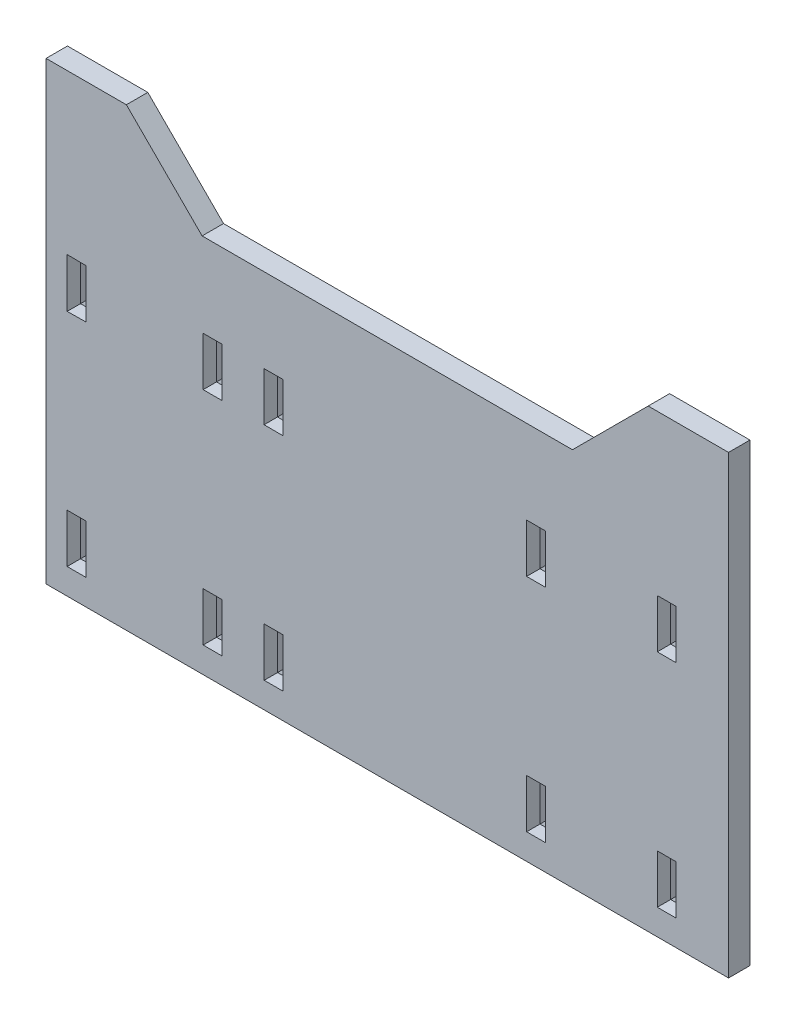
from build123d import *
from OCP.BRepFilletAPI import BRepFilletAPI_MakeChamfer

# Parameters (mm, degrees)
SKETCH1_W           = 127.440194606
SKETCH1_H           = 60
SKETCH1_W_2         = 3.53
SKETCH1_H_2         = 9.11399265
BOSS_EXTRUDE1_DEPTH = 4
BOSS_EXTRUDE2_DEPTH = 4
CHAMFER1_SIZE       = 1.5
CHAMFER1_SIZE2      = 0.5


with BuildPart() as part:
    # Sketch1 → Boss-Extrude1 (new body)
    with BuildSketch(Plane.XY):
        Rectangle(SKETCH1_W, SKETCH1_H)
        with Locations((-32.620097303, 20.65)):
            Rectangle(SKETCH1_W_2, SKETCH1_H_2, mode=Mode.SUBTRACT)
        with Locations((27.7799027, 20.65)):
            Rectangle(SKETCH1_W_2, SKETCH1_H_2, mode=Mode.SUBTRACT)
        with Locations((27.7799027, -20.65)):
            Rectangle(SKETCH1_W_2, SKETCH1_H_2, mode=Mode.SUBTRACT)
        Polygon((-19.455133439, 25.206990566), (-22.985061166, 25.184401952), (-22.999551776, 16.115598048), (-19.440642829, 16.093009434), align=None, mode=Mode.SUBTRACT)
        with Locations((-21.220097303, -20.65)):
            Rectangle(SKETCH1_W_2, SKETCH1_H_2, mode=Mode.SUBTRACT)
        with Locations((52.1799027, 20.65)):
            Rectangle(SKETCH1_W_2, SKETCH1_H_2, mode=Mode.SUBTRACT)
        with Locations((52.1799027, -20.65)):
            Rectangle(SKETCH1_W_2, SKETCH1_H_2, mode=Mode.SUBTRACT)
        with Locations((-32.620097303, -20.65)):
            Rectangle(SKETCH1_W_2, SKETCH1_H_2, mode=Mode.SUBTRACT)
        Polygon((-59.784966326, 25.25), (-56.255228279, 25.206996325), (-56.255228279, 16.093003675), (-59.784966326, 16.05), align=None, mode=Mode.SUBTRACT)
        with Locations((-58.020097303, -20.65)):
            Rectangle(SKETCH1_W_2, SKETCH1_H_2, mode=Mode.SUBTRACT)
    extrude(amount=-BOSS_EXTRUDE1_DEPTH)

    # Sketch2 → Boss-Extrude2 (add)
    with BuildSketch(Plane.XY):
        Polygon((-63.720097303, 30), (-63.720097303, 55), (-48.720097303, 55), (-34.577961679, 40.857864376), (34.577961679, 40.857864376), (48.720097303, 55), (63.720097303, 55), (63.720097303, 30), align=None)
    extrude(amount=-BOSS_EXTRUDE2_DEPTH)

    # Chamfer1: one chamfer whose edges measure the first distance from different faces: ONE call of the kernel's chamfer builder (chamfer() names one face for all edges)
    chamfer1_edges_1 = [part.edges().sort_by_distance(p)[0] for p in [
        (27.7799027, 16.093003675, -4),
    ]]
    chamfer1_side_1 = [part.faces().sort_by_distance(p)[0] for p in [
        (27.7799027, 16.093003675, -2),
    ]]
    chamfer1_edges_2 = [part.edges().sort_by_distance(p)[0] for p in [
        (29.5449027, 20.65, -4),
    ]]
    chamfer1_side_2 = [part.faces().sort_by_distance(p)[0] for p in [
        (29.5449027, 20.65, -2),
    ]]
    chamfer1_edges_3 = [part.edges().sort_by_distance(p)[0] for p in [
        (26.0149027, 20.65, -4),
    ]]
    chamfer1_side_3 = [part.faces().sort_by_distance(p)[0] for p in [
        (26.0149027, 20.65, -2),
    ]]
    chamfer1_edges_4 = [part.edges().sort_by_distance(p)[0] for p in [
        (27.7799027, 25.206996325, -4),
    ]]
    chamfer1_side_4 = [part.faces().sort_by_distance(p)[0] for p in [
        (27.7799027, 25.206996325, -2),
    ]]
    chamfer1_edges_5 = [part.edges().sort_by_distance(p)[0] for p in [
        (53.9449027, 20.65, -4),
    ]]
    chamfer1_side_5 = [part.faces().sort_by_distance(p)[0] for p in [
        (53.9449027, 20.65, -2),
    ]]
    chamfer1_edges_6 = [part.edges().sort_by_distance(p)[0] for p in [
        (52.1799027, 16.093003675, -4),
    ]]
    chamfer1_side_6 = [part.faces().sort_by_distance(p)[0] for p in [
        (52.1799027, 16.093003675, -2),
    ]]
    chamfer1_edges_7 = [part.edges().sort_by_distance(p)[0] for p in [
        (50.4149027, 20.65, -4),
    ]]
    chamfer1_side_7 = [part.faces().sort_by_distance(p)[0] for p in [
        (50.4149027, 20.65, -2),
    ]]
    chamfer1_edges_8 = [part.edges().sort_by_distance(p)[0] for p in [
        (52.1799027, 25.206996325, -4),
    ]]
    chamfer1_side_8 = [part.faces().sort_by_distance(p)[0] for p in [
        (52.1799027, 25.206996325, -2),
    ]]
    chamfer1_edges_9 = [part.edges().sort_by_distance(p)[0] for p in [
        (52.1799027, -25.206996325, -4),
    ]]
    chamfer1_side_9 = [part.faces().sort_by_distance(p)[0] for p in [
        (52.1799027, -25.206996325, -2),
    ]]
    chamfer1_edges_10 = [part.edges().sort_by_distance(p)[0] for p in [
        (53.9449027, -20.65, -4),
    ]]
    chamfer1_side_10 = [part.faces().sort_by_distance(p)[0] for p in [
        (53.9449027, -20.65, -2),
    ]]
    chamfer1_edges_11 = [part.edges().sort_by_distance(p)[0] for p in [
        (52.1799027, -16.093003675, -4),
    ]]
    chamfer1_side_11 = [part.faces().sort_by_distance(p)[0] for p in [
        (52.1799027, -16.093003675, -2),
    ]]
    chamfer1_edges_12 = [part.edges().sort_by_distance(p)[0] for p in [
        (50.4149027, -20.65, -4),
    ]]
    chamfer1_side_12 = [part.faces().sort_by_distance(p)[0] for p in [
        (50.4149027, -20.65, -2),
    ]]
    chamfer1_edges_13 = [part.edges().sort_by_distance(p)[0] for p in [
        (29.5449027, -20.65, -4),
    ]]
    chamfer1_side_13 = [part.faces().sort_by_distance(p)[0] for p in [
        (29.5449027, -20.65, -2),
    ]]
    chamfer1_edges_14 = [part.edges().sort_by_distance(p)[0] for p in [
        (27.7799027, -25.206996325, -4),
    ]]
    chamfer1_side_14 = [part.faces().sort_by_distance(p)[0] for p in [
        (27.7799027, -25.206996325, -2),
    ]]
    chamfer1_edges_15 = [part.edges().sort_by_distance(p)[0] for p in [
        (26.0149027, -20.65, -4),
    ]]
    chamfer1_side_15 = [part.faces().sort_by_distance(p)[0] for p in [
        (26.0149027, -20.65, -2),
    ]]
    chamfer1_edges_16 = [part.edges().sort_by_distance(p)[0] for p in [
        (27.7799027, -16.093003675, -4),
    ]]
    chamfer1_side_16 = [part.faces().sort_by_distance(p)[0] for p in [
        (27.7799027, -16.093003675, -2),
    ]]
    chamfer1_edges_17 = [part.edges().sort_by_distance(p)[0] for p in [
        (-21.220097303, -25.206996325, -4),
    ]]
    chamfer1_side_17 = [part.faces().sort_by_distance(p)[0] for p in [
        (-21.220097303, -25.206996325, -2),
    ]]
    chamfer1_edges_18 = [part.edges().sort_by_distance(p)[0] for p in [
        (-19.455097303, -20.65, -4),
    ]]
    chamfer1_side_18 = [part.faces().sort_by_distance(p)[0] for p in [
        (-19.455097303, -20.65, -2),
    ]]
    chamfer1_edges_19 = [part.edges().sort_by_distance(p)[0] for p in [
        (-21.220097303, -16.093003675, -4),
    ]]
    chamfer1_side_19 = [part.faces().sort_by_distance(p)[0] for p in [
        (-21.220097303, -16.093003675, -2),
    ]]
    chamfer1_edges_20 = [part.edges().sort_by_distance(p)[0] for p in [
        (-22.985097303, -20.65, -4),
    ]]
    chamfer1_side_20 = [part.faces().sort_by_distance(p)[0] for p in [
        (-22.985097303, -20.65, -2),
    ]]
    chamfer1_edges_21 = [part.edges().sort_by_distance(p)[0] for p in [
        (-30.855097303, -20.65, -4),
    ]]
    chamfer1_side_21 = [part.faces().sort_by_distance(p)[0] for p in [
        (-30.855097303, -20.65, -2),
    ]]
    chamfer1_edges_22 = [part.edges().sort_by_distance(p)[0] for p in [
        (-32.620097303, -25.206996325, -4),
    ]]
    chamfer1_side_22 = [part.faces().sort_by_distance(p)[0] for p in [
        (-32.620097303, -25.206996325, -2),
    ]]
    chamfer1_edges_23 = [part.edges().sort_by_distance(p)[0] for p in [
        (-34.385097303, -20.65, -4),
    ]]
    chamfer1_side_23 = [part.faces().sort_by_distance(p)[0] for p in [
        (-34.385097303, -20.65, -2),
    ]]
    chamfer1_edges_24 = [part.edges().sort_by_distance(p)[0] for p in [
        (-32.620097303, -16.093003675, -4),
    ]]
    chamfer1_side_24 = [part.faces().sort_by_distance(p)[0] for p in [
        (-32.620097303, -16.093003675, -2),
    ]]
    chamfer1_edges_25 = [part.edges().sort_by_distance(p)[0] for p in [
        (-56.255097303, -20.65, -4),
    ]]
    chamfer1_side_25 = [part.faces().sort_by_distance(p)[0] for p in [
        (-56.255097303, -20.65, -2),
    ]]
    chamfer1_edges_26 = [part.edges().sort_by_distance(p)[0] for p in [
        (-58.020097303, -16.093003675, -4),
    ]]
    chamfer1_side_26 = [part.faces().sort_by_distance(p)[0] for p in [
        (-58.020097303, -16.093003675, -2),
    ]]
    chamfer1_edges_27 = [part.edges().sort_by_distance(p)[0] for p in [
        (-59.785097303, -20.65, -4),
    ]]
    chamfer1_side_27 = [part.faces().sort_by_distance(p)[0] for p in [
        (-59.785097303, -20.65, -2),
    ]]
    chamfer1_edges_28 = [part.edges().sort_by_distance(p)[0] for p in [
        (-58.020097303, -25.206996325, -4),
    ]]
    chamfer1_side_28 = [part.faces().sort_by_distance(p)[0] for p in [
        (-58.020097303, -25.206996325, -2),
    ]]
    chamfer1_edges_29 = [part.edges().sort_by_distance(p)[0] for p in [
        (-21.220097303, 25.195696259, -4),
    ]]
    chamfer1_side_29 = [part.faces().sort_by_distance(p)[0] for p in [
        (-21.220097303, 25.195696259, -2),
    ]]
    chamfer1_edges_30 = [part.edges().sort_by_distance(p)[0] for p in [
        (-19.447888134, 20.65, -4),
    ]]
    chamfer1_side_30 = [part.faces().sort_by_distance(p)[0] for p in [
        (-19.447888134, 20.65, -2),
    ]]
    chamfer1_edges_31 = [part.edges().sort_by_distance(p)[0] for p in [
        (-21.220097303, 16.104303741, -4),
    ]]
    chamfer1_side_31 = [part.faces().sort_by_distance(p)[0] for p in [
        (-21.220097303, 16.104303741, -2),
    ]]
    chamfer1_edges_32 = [part.edges().sort_by_distance(p)[0] for p in [
        (-22.992306471, 20.65, -4),
    ]]
    chamfer1_side_32 = [part.faces().sort_by_distance(p)[0] for p in [
        (-22.992306471, 20.65, -2),
    ]]
    chamfer1_edges_33 = [part.edges().sort_by_distance(p)[0] for p in [
        (-32.620097303, 16.093003675, -4),
    ]]
    chamfer1_side_33 = [part.faces().sort_by_distance(p)[0] for p in [
        (-32.620097303, 16.093003675, -2),
    ]]
    chamfer1_edges_34 = [part.edges().sort_by_distance(p)[0] for p in [
        (-30.855097303, 20.65, -4),
    ]]
    chamfer1_side_34 = [part.faces().sort_by_distance(p)[0] for p in [
        (-30.855097303, 20.65, -2),
    ]]
    chamfer1_edges_35 = [part.edges().sort_by_distance(p)[0] for p in [
        (-32.620097303, 25.206996325, -4),
    ]]
    chamfer1_side_35 = [part.faces().sort_by_distance(p)[0] for p in [
        (-32.620097303, 25.206996325, -2),
    ]]
    chamfer1_edges_36 = [part.edges().sort_by_distance(p)[0] for p in [
        (-34.385097303, 20.65, -4),
    ]]
    chamfer1_side_36 = [part.faces().sort_by_distance(p)[0] for p in [
        (-34.385097303, 20.65, -2),
    ]]
    chamfer1_edges_37 = [part.edges().sort_by_distance(p)[0] for p in [
        (-58.020097303, 16.071501837, -4),
    ]]
    chamfer1_side_37 = [part.faces().sort_by_distance(p)[0] for p in [
        (-58.020097303, 16.071501837, -2),
    ]]
    chamfer1_edges_38 = [part.edges().sort_by_distance(p)[0] for p in [
        (-56.255228279, 20.65, -4),
    ]]
    chamfer1_side_38 = [part.faces().sort_by_distance(p)[0] for p in [
        (-56.255228279, 20.65, -2),
    ]]
    chamfer1_edges_39 = [part.edges().sort_by_distance(p)[0] for p in [
        (-58.020097303, 25.228498163, -4),
    ]]
    chamfer1_side_39 = [part.faces().sort_by_distance(p)[0] for p in [
        (-58.020097303, 25.228498163, -2),
    ]]
    chamfer1_edges_40 = [part.edges().sort_by_distance(p)[0] for p in [
        (-59.784966326, 20.65, -4),
    ]]
    chamfer1_side_40 = [part.faces().sort_by_distance(p)[0] for p in [
        (-59.784966326, 20.65, -2),
    ]]
    chamfer1 = BRepFilletAPI_MakeChamfer(part.part.solid().wrapped)
    for e in chamfer1_edges_1:
        chamfer1.Add(CHAMFER1_SIZE, CHAMFER1_SIZE2, e.wrapped, chamfer1_side_1[0].wrapped)  # the first distance lies on this face
    for e in chamfer1_edges_2:
        chamfer1.Add(CHAMFER1_SIZE, CHAMFER1_SIZE2, e.wrapped, chamfer1_side_2[0].wrapped)  # the first distance lies on this face
    for e in chamfer1_edges_3:
        chamfer1.Add(CHAMFER1_SIZE, CHAMFER1_SIZE2, e.wrapped, chamfer1_side_3[0].wrapped)  # the first distance lies on this face
    for e in chamfer1_edges_4:
        chamfer1.Add(CHAMFER1_SIZE, CHAMFER1_SIZE2, e.wrapped, chamfer1_side_4[0].wrapped)  # the first distance lies on this face
    for e in chamfer1_edges_5:
        chamfer1.Add(CHAMFER1_SIZE, CHAMFER1_SIZE2, e.wrapped, chamfer1_side_5[0].wrapped)  # the first distance lies on this face
    for e in chamfer1_edges_6:
        chamfer1.Add(CHAMFER1_SIZE, CHAMFER1_SIZE2, e.wrapped, chamfer1_side_6[0].wrapped)  # the first distance lies on this face
    for e in chamfer1_edges_7:
        chamfer1.Add(CHAMFER1_SIZE, CHAMFER1_SIZE2, e.wrapped, chamfer1_side_7[0].wrapped)  # the first distance lies on this face
    for e in chamfer1_edges_8:
        chamfer1.Add(CHAMFER1_SIZE, CHAMFER1_SIZE2, e.wrapped, chamfer1_side_8[0].wrapped)  # the first distance lies on this face
    for e in chamfer1_edges_9:
        chamfer1.Add(CHAMFER1_SIZE, CHAMFER1_SIZE2, e.wrapped, chamfer1_side_9[0].wrapped)  # the first distance lies on this face
    for e in chamfer1_edges_10:
        chamfer1.Add(CHAMFER1_SIZE, CHAMFER1_SIZE2, e.wrapped, chamfer1_side_10[0].wrapped)  # the first distance lies on this face
    for e in chamfer1_edges_11:
        chamfer1.Add(CHAMFER1_SIZE, CHAMFER1_SIZE2, e.wrapped, chamfer1_side_11[0].wrapped)  # the first distance lies on this face
    for e in chamfer1_edges_12:
        chamfer1.Add(CHAMFER1_SIZE, CHAMFER1_SIZE2, e.wrapped, chamfer1_side_12[0].wrapped)  # the first distance lies on this face
    for e in chamfer1_edges_13:
        chamfer1.Add(CHAMFER1_SIZE, CHAMFER1_SIZE2, e.wrapped, chamfer1_side_13[0].wrapped)  # the first distance lies on this face
    for e in chamfer1_edges_14:
        chamfer1.Add(CHAMFER1_SIZE, CHAMFER1_SIZE2, e.wrapped, chamfer1_side_14[0].wrapped)  # the first distance lies on this face
    for e in chamfer1_edges_15:
        chamfer1.Add(CHAMFER1_SIZE, CHAMFER1_SIZE2, e.wrapped, chamfer1_side_15[0].wrapped)  # the first distance lies on this face
    for e in chamfer1_edges_16:
        chamfer1.Add(CHAMFER1_SIZE, CHAMFER1_SIZE2, e.wrapped, chamfer1_side_16[0].wrapped)  # the first distance lies on this face
    for e in chamfer1_edges_17:
        chamfer1.Add(CHAMFER1_SIZE, CHAMFER1_SIZE2, e.wrapped, chamfer1_side_17[0].wrapped)  # the first distance lies on this face
    for e in chamfer1_edges_18:
        chamfer1.Add(CHAMFER1_SIZE, CHAMFER1_SIZE2, e.wrapped, chamfer1_side_18[0].wrapped)  # the first distance lies on this face
    for e in chamfer1_edges_19:
        chamfer1.Add(CHAMFER1_SIZE, CHAMFER1_SIZE2, e.wrapped, chamfer1_side_19[0].wrapped)  # the first distance lies on this face
    for e in chamfer1_edges_20:
        chamfer1.Add(CHAMFER1_SIZE, CHAMFER1_SIZE2, e.wrapped, chamfer1_side_20[0].wrapped)  # the first distance lies on this face
    for e in chamfer1_edges_21:
        chamfer1.Add(CHAMFER1_SIZE, CHAMFER1_SIZE2, e.wrapped, chamfer1_side_21[0].wrapped)  # the first distance lies on this face
    for e in chamfer1_edges_22:
        chamfer1.Add(CHAMFER1_SIZE, CHAMFER1_SIZE2, e.wrapped, chamfer1_side_22[0].wrapped)  # the first distance lies on this face
    for e in chamfer1_edges_23:
        chamfer1.Add(CHAMFER1_SIZE, CHAMFER1_SIZE2, e.wrapped, chamfer1_side_23[0].wrapped)  # the first distance lies on this face
    for e in chamfer1_edges_24:
        chamfer1.Add(CHAMFER1_SIZE, CHAMFER1_SIZE2, e.wrapped, chamfer1_side_24[0].wrapped)  # the first distance lies on this face
    for e in chamfer1_edges_25:
        chamfer1.Add(CHAMFER1_SIZE, CHAMFER1_SIZE2, e.wrapped, chamfer1_side_25[0].wrapped)  # the first distance lies on this face
    for e in chamfer1_edges_26:
        chamfer1.Add(CHAMFER1_SIZE, CHAMFER1_SIZE2, e.wrapped, chamfer1_side_26[0].wrapped)  # the first distance lies on this face
    for e in chamfer1_edges_27:
        chamfer1.Add(CHAMFER1_SIZE, CHAMFER1_SIZE2, e.wrapped, chamfer1_side_27[0].wrapped)  # the first distance lies on this face
    for e in chamfer1_edges_28:
        chamfer1.Add(CHAMFER1_SIZE, CHAMFER1_SIZE2, e.wrapped, chamfer1_side_28[0].wrapped)  # the first distance lies on this face
    for e in chamfer1_edges_29:
        chamfer1.Add(CHAMFER1_SIZE, CHAMFER1_SIZE2, e.wrapped, chamfer1_side_29[0].wrapped)  # the first distance lies on this face
    for e in chamfer1_edges_30:
        chamfer1.Add(CHAMFER1_SIZE, CHAMFER1_SIZE2, e.wrapped, chamfer1_side_30[0].wrapped)  # the first distance lies on this face
    for e in chamfer1_edges_31:
        chamfer1.Add(CHAMFER1_SIZE, CHAMFER1_SIZE2, e.wrapped, chamfer1_side_31[0].wrapped)  # the first distance lies on this face
    for e in chamfer1_edges_32:
        chamfer1.Add(CHAMFER1_SIZE, CHAMFER1_SIZE2, e.wrapped, chamfer1_side_32[0].wrapped)  # the first distance lies on this face
    for e in chamfer1_edges_33:
        chamfer1.Add(CHAMFER1_SIZE, CHAMFER1_SIZE2, e.wrapped, chamfer1_side_33[0].wrapped)  # the first distance lies on this face
    for e in chamfer1_edges_34:
        chamfer1.Add(CHAMFER1_SIZE, CHAMFER1_SIZE2, e.wrapped, chamfer1_side_34[0].wrapped)  # the first distance lies on this face
    for e in chamfer1_edges_35:
        chamfer1.Add(CHAMFER1_SIZE, CHAMFER1_SIZE2, e.wrapped, chamfer1_side_35[0].wrapped)  # the first distance lies on this face
    for e in chamfer1_edges_36:
        chamfer1.Add(CHAMFER1_SIZE, CHAMFER1_SIZE2, e.wrapped, chamfer1_side_36[0].wrapped)  # the first distance lies on this face
    for e in chamfer1_edges_37:
        chamfer1.Add(CHAMFER1_SIZE, CHAMFER1_SIZE2, e.wrapped, chamfer1_side_37[0].wrapped)  # the first distance lies on this face
    for e in chamfer1_edges_38:
        chamfer1.Add(CHAMFER1_SIZE, CHAMFER1_SIZE2, e.wrapped, chamfer1_side_38[0].wrapped)  # the first distance lies on this face
    for e in chamfer1_edges_39:
        chamfer1.Add(CHAMFER1_SIZE, CHAMFER1_SIZE2, e.wrapped, chamfer1_side_39[0].wrapped)  # the first distance lies on this face
    for e in chamfer1_edges_40:
        chamfer1.Add(CHAMFER1_SIZE, CHAMFER1_SIZE2, e.wrapped, chamfer1_side_40[0].wrapped)  # the first distance lies on this face
    add(Compound.cast(chamfer1.Shape()), mode=Mode.REPLACE)


solid = part.part
